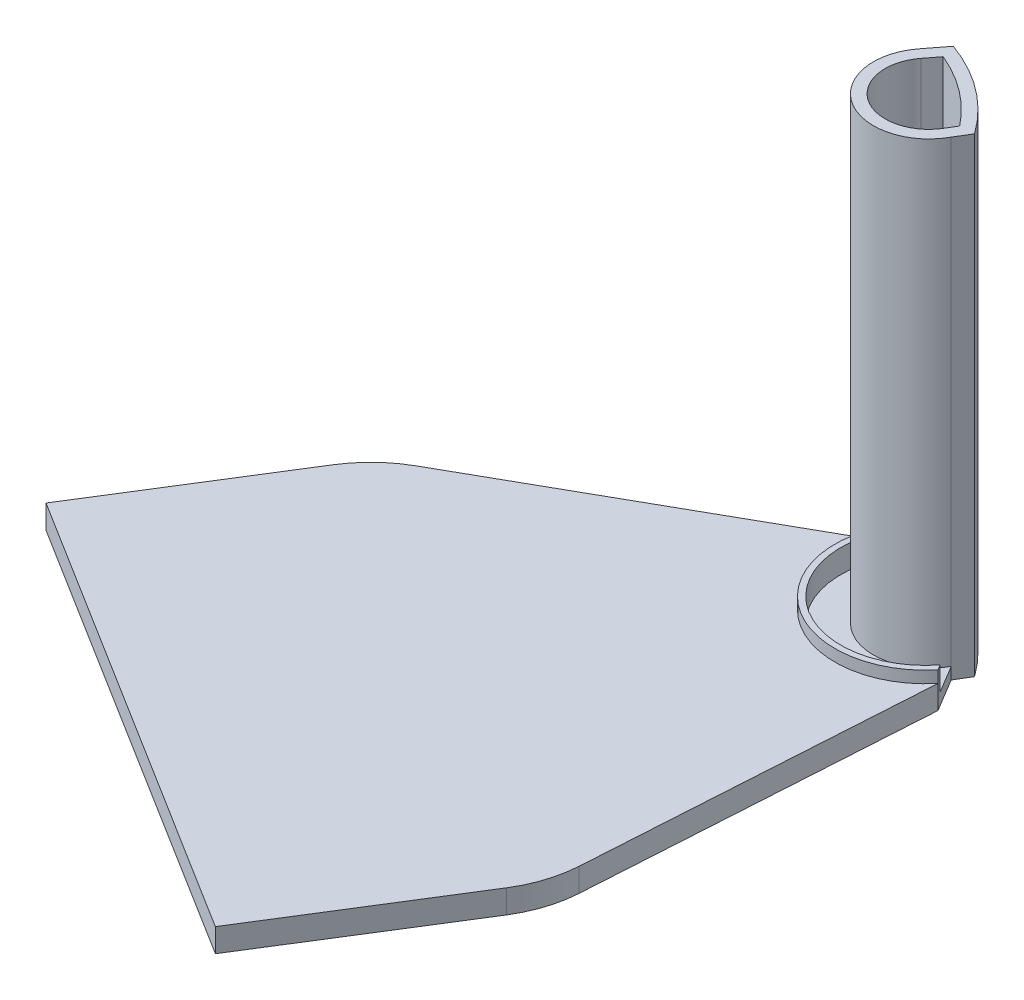
from build123d import *

# Parameters (mm, degrees)
SALIENTE_EXTRUIR3_DEPTH = 1
SALIENTE_EXTRUIR4_DEPTH = 2
SALIENTE_EXTRUIR5_DEPTH = 40
SALIENTE_EXTRUIR6_DEPTH = 2


with BuildPart() as part:
    # Croquis3 → Saliente-Extruir3 (new body)
    with BuildSketch(Plane(origin=(0, 0, 0), x_dir=(1, 0, 0), z_dir=(0, 1, 0))):
        with BuildLine():
            Line((-8.035911824, 0.88857317), (-4.660164738, 0.738374056))
            ThreePointArc((-4.660164738, 0.738374056), (-3.491878014, -6.094633439), (3.225323709, -4.38171595))
            Line((3.225323709, -4.38171595), (4.917369229, -7.202342932))
            ThreePointArc((4.917369229, -7.202342932), (-5.114744648, -8.849076594), (-8.035911824, 0.88857317))
        make_face()
    extrude(amount=SALIENTE_EXTRUIR3_DEPTH)

    # Croquis4 → Saliente-Extruir4 (add)
    with BuildSketch(Plane(origin=(0, 1, 0), x_dir=(1, 0, 0), z_dir=(0, 1, 0))):
        with BuildLine():
            Line((4.917369229, -7.202342932), (4.642987805, -6.74495119))
            ThreePointArc((4.642987805, -6.74495119), (-4.860151229, -8.418565495), (-7.493817117, 0.864453429))
            Line((-7.493817117, 0.864453429), (-8.035911824, 0.88857317))
            ThreePointArc((-8.035911824, 0.88857317), (-5.114744648, -8.849076594), (4.917369229, -7.202342932))
        make_face()
    extrude(amount=SALIENTE_EXTRUIR4_DEPTH)

    # Croquis1 → Saliente-Extruir5 (add)
    with BuildSketch(Plane(origin=(0, 0, 0), x_dir=(1, 0, 0), z_dir=(0, 1, 0))):
        with BuildLine():
            Line((-4.660164738, 0.738374056), (-3.38107943, 2.399345645))
            ThreePointArc((-3.38107943, 2.399345645), (0.723456308, 0.1886696), (3.976176138, -3.151108223))
            Line((3.976176138, -3.151108223), (3.225323709, -4.38171595))
            ThreePointArc((3.225323709, -4.38171595), (-3.491878014, -6.094633439), (-4.660164738, 0.738374056))
        make_face()
        with BuildLine():
            Line((-3.867867022, 0.128239376), (-3.043523867, 1.19870008))
            ThreePointArc((-3.043523867, 1.19870008), (0.147575108, -0.629578738), (2.769944661, -3.208123684))
            Line((2.769944661, -3.208123684), (2.357240199, -3.884524638))
            ThreePointArc((2.357240199, -3.884524638), (-2.936970885, -5.262605721), (-3.867867022, 0.128239376))
        make_face(mode=Mode.SUBTRACT)
    extrude(amount=SALIENTE_EXTRUIR5_DEPTH)

    # Croquis8 → Saliente-Extruir6 (add)
    with BuildSketch(Plane.XZ):
        with BuildLine():
            ThreePointArc((3.121797308, 35.939024727), (2.663211319, 38.370313658), (1.621742308, 40.614597347))
            Line((1.621742308, 40.614597347), (-7.903634902, 55.858387398))
            Line((-7.903634902, 55.858387398), (-46.320213658, 31.853044728))
            Line((-46.320213658, 31.853044728), (-36.913147682, 16.798592231))
            ThreePointArc((-36.913147682, 16.798592231), (-35.343131478, 14.869681606), (-33.345658311, 13.38787594))
            Line((-33.345658311, 13.38787594), (-8.035911824, -0.88857317))
            ThreePointArc((-8.035911824, -0.88857317), (-5.114744648, 8.849076594), (4.917369229, 7.202342932))
            Line((4.917369229, 7.202342932), (3.121797308, 35.939024727))
        make_face()
    extrude(amount=-SALIENTE_EXTRUIR6_DEPTH)


solid = part.part
